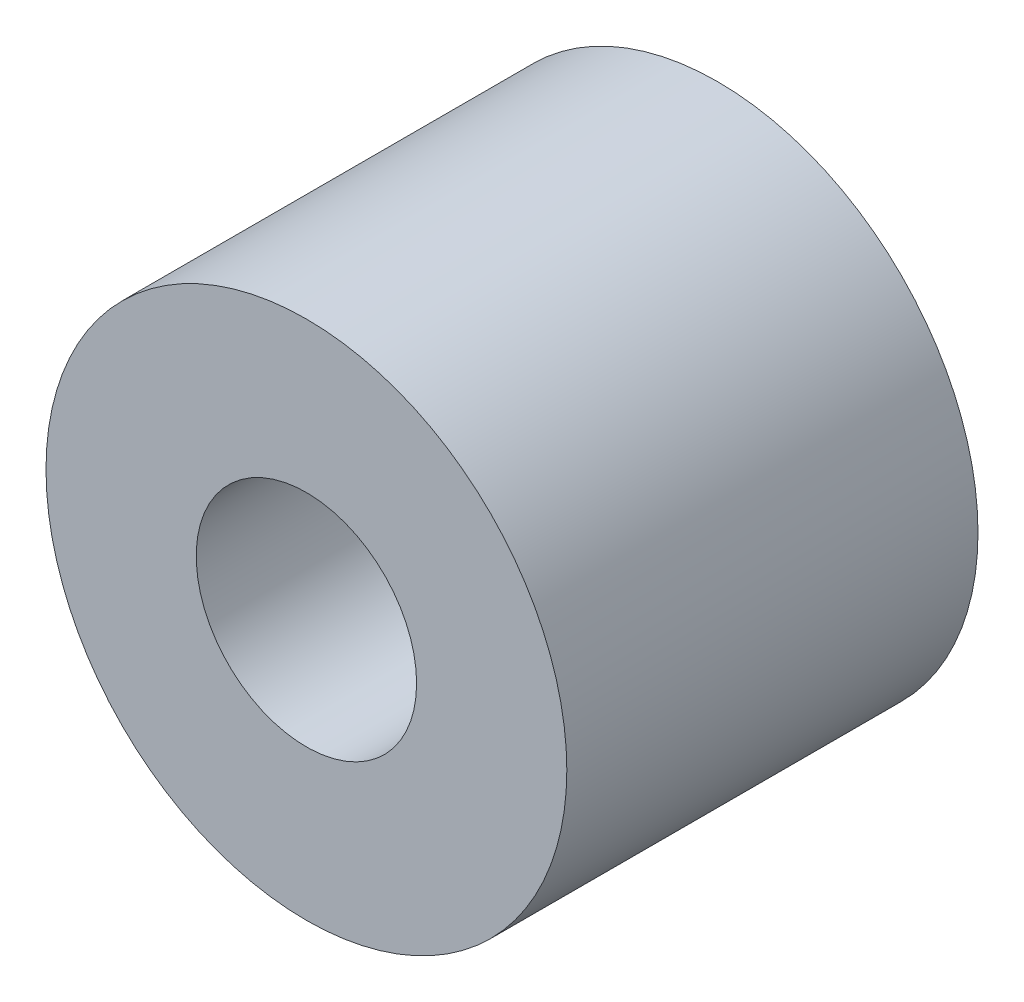
from build123d import *

# Parameters (mm, degrees)
SKETCH1_R                   = 6.0325
BOSS_EXTRUDE1_DEPTH         = 4.7625
TAP_DRILL_FOR_1_4_20_TAP1_D = 5.1054


with BuildPart() as part:
    # Sketch1 → Boss-Extrude1 (new, symmetric)
    with BuildSketch(Plane.XY):
        Circle(SKETCH1_R)
    extrude(amount=BOSS_EXTRUDE1_DEPTH, both=True)

    # Tap Drill for 1/4-20 Tap1 (through all)
    with Locations(Plane.XY.offset(4.7625)):
        with Locations((0, 0)):
            Hole(TAP_DRILL_FOR_1_4_20_TAP1_D / 2)


solid = part.part
